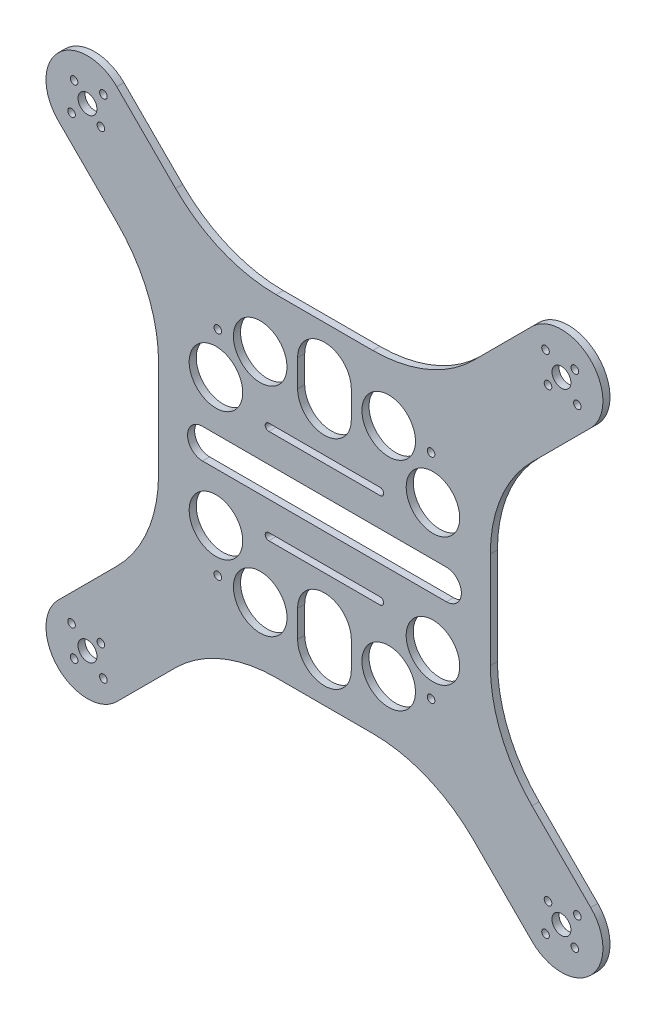
from build123d import *

# Parameters (mm, degrees)
SKETCH1_R           = 4
SKETCH1_R_2         = 3.999999999
SKETCH1_R_3         = 4.000000001
SKETCH1_R_4         = 4.000000002
SKETCH1_R_5         = 11.299517889
BOSS_EXTRUDE2_DEPTH = 3
SKETCH2_R           = 1.600000003
SKETCH2_R_2         = 1.599999997
CUT_EXTRUDE1_DEPTH  = 10
SKETCH3_R           = 1.6
CUT_EXTRUDE2_DEPTH  = 10
SKETCH4_W           = 50
SKETCH4_H           = 3
CUT_EXTRUDE3_DEPTH  = 167.197172059
FILLET1_R           = 1.5
FILLET2_R           = 1.5


with BuildPart() as part:
    # Sketch1 → Boss-Extrude2 (new body)
    with BuildSketch(Plane.XY):
        with BuildLine():
            Line((-112.374368671, 87.62563133), (-87.573593128, 62.824855788))
            ThreePointArc((-87.573593128, 62.824855788), (-74.567228049, 43.359454858), (-70, 20.398448917))
            Line((-70, 20.398448917), (-70, -20.398448916))
            ThreePointArc((-70, -20.398448916), (-74.567228049, -43.359454858), (-87.573593128, -62.824855787))
            Line((-87.573593128, -62.824855787), (-112.374368671, -87.625631329))
            ThreePointArc((-112.374368671, -87.625631329), (-112.374368671, -112.374368671), (-87.625631329, -112.374368671))
            Line((-87.625631329, -112.374368671), (-62.824855787, -87.573593129))
            ThreePointArc((-62.824855787, -87.573593129), (-43.359454858, -74.567228049), (-20.398448916, -70))
            Line((-20.398448916, -70), (20.398448917, -70))
            ThreePointArc((20.398448917, -70), (43.359454859, -74.567228049), (62.824855788, -87.573593129))
            Line((62.824855788, -87.573593129), (87.62563133, -112.374368671))
            ThreePointArc((87.62563133, -112.374368671), (112.374368671, -112.374368671), (112.374368671, -87.625631329))
            Line((112.374368671, -87.625631329), (87.573593129, -62.824855787))
            ThreePointArc((87.573593129, -62.824855787), (74.567228049, -43.359454858), (70, -20.398448916))
            Line((70, -20.398448916), (70, 20.398448916))
            ThreePointArc((70, 20.398448916), (74.567228049, 43.359454858), (87.573593129, 62.824855788))
            Line((87.573593129, 62.824855788), (112.374368671, 87.62563133))
            ThreePointArc((112.374368671, 87.62563133), (112.374368671, 112.374368671), (87.62563133, 112.374368671))
            Line((87.62563133, 112.374368671), (62.824855788, 87.573593129))
            ThreePointArc((62.824855788, 87.573593129), (43.359454858, 74.56722805), (20.398448916, 70))
            Line((20.398448916, 70), (-20.398448916, 70))
            ThreePointArc((-20.398448916, 70), (-43.359454858, 74.56722805), (-62.824855787, 87.573593129))
            Line((-62.824855787, 87.573593129), (-87.625631329, 112.374368671))
            ThreePointArc((-87.625631329, 112.374368671), (-112.374368671, 112.374368671), (-112.374368671, 87.62563133))
        make_face()
        with Locations((-100.000000001, 100.000000001)):
            Circle(SKETCH1_R, mode=Mode.SUBTRACT)
        with Locations((100.000000001, 100.000000001)):
            Circle(SKETCH1_R_2, mode=Mode.SUBTRACT)
        with Locations((100.000000001, -100.000000004)):
            Circle(SKETCH1_R_3, mode=Mode.SUBTRACT)
        with Locations((-100.000000001, -100.000000004)):
            Circle(SKETCH1_R_4, mode=Mode.SUBTRACT)
        with Locations((-27.108358193, -45.792037353)):
            Circle(SKETCH1_R_5, mode=Mode.SUBTRACT)
        with Locations(Location((27.108358193, -45.792037353, 0), (0, 0, 180))):
            Circle(SKETCH1_R_5, mode=Mode.SUBTRACT)
        with Locations((27.108358193, 45.792037353)):
            Circle(SKETCH1_R_5, mode=Mode.SUBTRACT)
        with Locations(Location((-27.108358193, 45.792037353, 0), (0, 0, 180))):
            Circle(SKETCH1_R_5, mode=Mode.SUBTRACT)
        with Locations(Location((-45.792037353, -27.108358193, 0), (0, 0, 180))):
            Circle(SKETCH1_R_5, mode=Mode.SUBTRACT)
        with Locations((-45.792037353, 27.108358193)):
            Circle(SKETCH1_R_5, mode=Mode.SUBTRACT)
        with Locations((45.792037353, -27.108358193)):
            Circle(SKETCH1_R_5, mode=Mode.SUBTRACT)
        with Locations(Location((45.792037353, 27.108358193, 0), (0, 0, 180))):
            Circle(SKETCH1_R_5, mode=Mode.SUBTRACT)
        with BuildLine():
            Line((11.326328369, 51.455201537), (11.326328369, 40.128873169))
            ThreePointArc((11.326328369, 40.128873169), (0, 28.8025448), (-11.326328369, 40.128873169))
            Line((-11.326328369, 40.128873169), (-11.326328369, 51.455201537))
            ThreePointArc((-11.326328369, 51.455201537), (0, 62.781529906), (11.326328369, 51.455201537))
        make_face(mode=Mode.SUBTRACT)
        with BuildLine():
            Line((11.326328369, -51.455201537), (11.326328369, -40.128873169))
            ThreePointArc((11.326328369, -40.128873169), (0, -28.8025448), (-11.326328369, -40.128873169))
            Line((-11.326328369, -40.128873169), (-11.326328369, -51.455201537))
            ThreePointArc((-11.326328369, -51.455201537), (0, -62.781529906), (11.326328369, -51.455201537))
        make_face(mode=Mode.SUBTRACT)
        with BuildLine():
            Line((51.455201537, 6.326328369), (40.128873169, 6.326328369))
            Line((40.128873169, 6.326328369), (-40.128873169, 6.326328369))
            Line((-40.128873169, 6.326328369), (-51.455201537, 6.326328369))
            ThreePointArc((-51.455201537, 6.326328369), (-57.781529906, 0), (-51.455201537, -6.326328369))
            Line((-51.455201537, -6.326328369), (-40.128873169, -6.326328369))
            Line((-40.128873169, -6.326328369), (40.128873169, -6.326328369))
            Line((40.128873169, -6.326328369), (51.455201537, -6.326328369))
            ThreePointArc((51.455201537, -6.326328369), (57.781529906, 0), (51.455201537, 6.326328369))
        make_face(mode=Mode.SUBTRACT)
    extrude(amount=BOSS_EXTRUDE2_DEPTH)

    # Sketch2 → Cut-Extrude1 (cut)
    with BuildSketch(Plane.XY.offset(3)):
        with Locations((106.717514422, 93.282485579)):
            Circle(SKETCH2_R)
        with Locations((105.65685425, 105.65685425)):
            Circle(SKETCH2_R)
        with Locations((93.282485579, 106.717514422)):
            Circle(SKETCH2_R)
        with Locations((94.343145751, 94.343145751)):
            Circle(SKETCH2_R)
        with Locations((-94.343145751, 94.343145751)):
            Circle(SKETCH2_R_2)
        with Locations((-93.282485579, 106.717514422)):
            Circle(SKETCH2_R_2)
        with Locations((-105.65685425, 105.65685425)):
            Circle(SKETCH2_R_2)
        with Locations((-106.717514422, 93.282485579)):
            Circle(SKETCH2_R_2)
        with Locations((-106.717514422, -93.282485579)):
            Circle(SKETCH2_R_2)
        with Locations((-105.65685425, -105.65685425)):
            Circle(SKETCH2_R_2)
        with Locations((-93.282485579, -106.717514422)):
            Circle(SKETCH2_R_2)
        with Locations((-94.343145751, -94.343145751)):
            Circle(SKETCH2_R_2)
        with Locations((94.343145751, -94.343145751)):
            Circle(SKETCH2_R)
        with Locations((93.282485579, -106.717514422)):
            Circle(SKETCH2_R)
        with Locations((105.65685425, -105.65685425)):
            Circle(SKETCH2_R)
        with Locations((106.717514422, -93.282485579)):
            Circle(SKETCH2_R)
    extrude(amount=-CUT_EXTRUDE1_DEPTH, mode=Mode.SUBTRACT)

    # Sketch3 → Cut-Extrude2 (cut)
    with BuildSketch(Plane(origin=(0, 0, 0), x_dir=(-1, 0, 0), z_dir=(0, 0, -1))):
        with Locations((-45, -45)):
            Circle(SKETCH3_R)
        with Locations((-45, 45)):
            Circle(SKETCH3_R)
        with Locations((45, 45)):
            Circle(SKETCH3_R)
        with Locations((45, -45)):
            Circle(SKETCH3_R)
    extrude(amount=-CUT_EXTRUDE2_DEPTH, mode=Mode.SUBTRACT)

    # Sketch4 → Cut-Extrude3 (cut, through all)
    with BuildSketch(Plane(origin=(0, 0, 0), x_dir=(-1, 0, 0), z_dir=(0, 0, -1))):
        with Locations((0, -20)):
            Rectangle(SKETCH4_W, SKETCH4_H)
        with Locations((0, 20)):
            Rectangle(SKETCH4_W, SKETCH4_H)
    extrude(amount=-CUT_EXTRUDE3_DEPTH, mode=Mode.SUBTRACT)

    # Fillet1
    fillet1_edges = [part.edges().sort_by_distance(p)[0] for p in [
        (25, 21.5, 1.5),
        (25, 18.5, 1.5),
        (-25, 18.5, 1.5),
        (-25, 21.5, 1.5),
    ]]
    fillet(fillet1_edges, radius=FILLET1_R - 0.0001)  # a hair under: the kernel refuses the full size

    # Fillet2
    fillet2_edges = [part.edges().sort_by_distance(p)[0] for p in [
        (-25, -21.5, 1.5),
        (-25, -18.5, 1.5),
        (25, -21.5, 1.5),
        (25, -18.5, 1.5),
    ]]
    fillet(fillet2_edges, radius=FILLET2_R - 0.0001)  # a hair under: the kernel refuses the full size


solid = part.part
